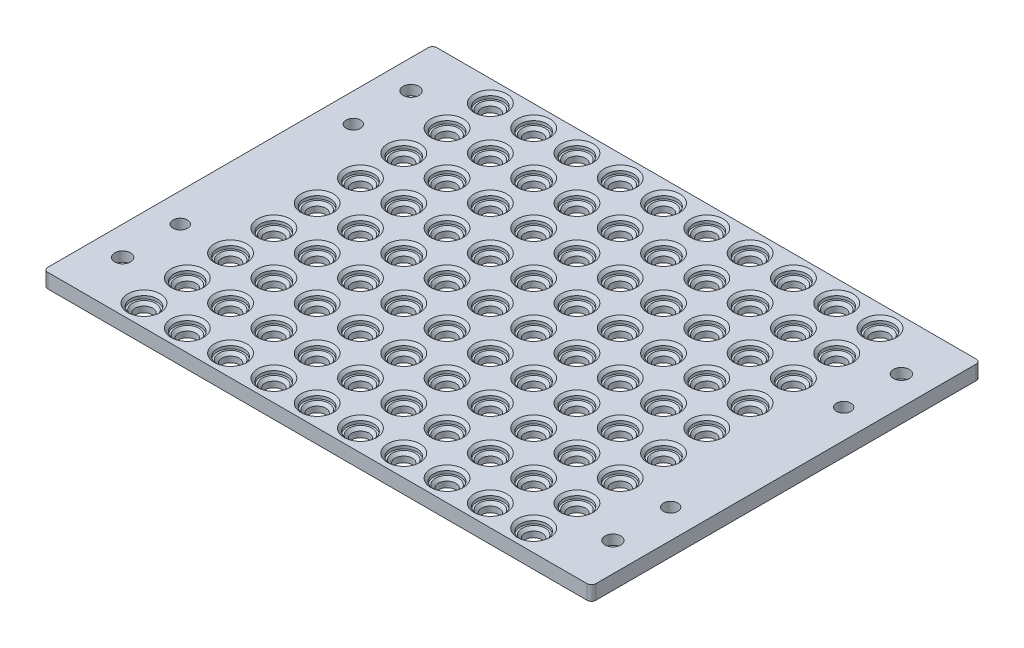
from build123d import *

# Parameters (mm, degrees)
SKETCH_1_W                         = 380
SKETCH_1_H                         = 269.8
EXTRUDE_1_DEPTH                    = 10
HOLE_WIZARD_1_D                    = 10
HOLE_WIZARD_3_D                    = 12
HOLE_WIZARD_4_D                    = 18.5
HOLE_WIZARD_4_DEPTH                = 4
CHAMFER_1_SIZE                     = 2
PATTERN_LINEAR_1_COUNT             = 10
PATTERN_LINEAR_1_PITCH             = 30.022
PATTERN_LINEAR_1_COUNT_DIR2        = 9
PATTERN_LINEAR_1_PITCH_DIR2        = 30.022
CHAMFER_1_OF_PATTERN_LINEAR_1_SIZE = 2
HOLE_WIZARD_1_2_D                  = 6.6
HOLE_WIZARD_1_2_CBORE_D            = 11
HOLE_WIZARD_1_2_CBORE_DEPTH        = 6.8
FILLET_1_R                         = 3


with BuildPart() as part:
    # 草图1 → 凸台-拉伸1 (new body)
    with BuildSketch(Plane(origin=(0, 0, 0), x_dir=(1, 0, 0), z_dir=(0, 1, 0))):
        Rectangle(SKETCH_1_W, SKETCH_1_H)
    extrude(amount=EXTRUDE_1_DEPTH)

    # Hole Wizard 1 (through all)
    with Locations(Plane(origin=(0, 10, 0), x_dir=(1, 0, 0), z_dir=(0, 1, 0))):
        with Locations((-170, 60), (170, 60), (170, -60), (-170, -60)):
            Hole(HOLE_WIZARD_1_D / 2)

    # 孔3 (through all)
    with Locations(Plane(origin=(0, 10, 0), x_dir=(1, 0, 0), z_dir=(0, 1, 0))):
        with Locations((135.099, -120.088)):
            hole_wizard_3 = Hole(HOLE_WIZARD_3_D / 2)

    # 孔4
    with Locations(Plane(origin=(0, 10, 0), x_dir=(1, 0, 0), z_dir=(0, 1, 0))):
        with Locations((135.099, -120.088)):
            hole_wizard_4 = Hole(HOLE_WIZARD_4_D / 2, depth=HOLE_WIZARD_4_DEPTH)

    # 倒角1
    chamfer_1_edges = [part.edges().sort_by_distance(p)[0] for p in [
        (141.099, 6, 120.088),
        (144.349, 10, 120.088),
    ]]
    chamfer(chamfer_1_edges, length=CHAMFER_1_SIZE)

    # 阵列(线性)1: 孔3, Hole Wizard 4 10 × 9
    with Locations(*[(-i * PATTERN_LINEAR_1_PITCH, 0, -j * PATTERN_LINEAR_1_PITCH_DIR2) for i in range(PATTERN_LINEAR_1_COUNT) for j in range(PATTERN_LINEAR_1_COUNT_DIR2) if (i, j) != (0, 0)]):
        add(hole_wizard_3, mode=Mode.SUBTRACT)
        add(hole_wizard_4, mode=Mode.SUBTRACT)

    # 倒角1 of 阵列(线性)1
    chamfer_1_of_pattern_linear_1_edges = [part.edges().sort_by_distance(p)[0] for p in [
        (141.099, 6, 90.066),
        (144.349, 10, 90.066),
        (141.099, 6, 60.044),
        (144.349, 10, 60.044),
        (141.099, 6, 30.022),
        (144.349, 10, 30.022),
        (141.099, 6, 0),
        (144.349, 10, 0),
        (141.099, 6, -30.022),
        (144.349, 10, -30.022),
        (141.099, 6, -60.044),
        (144.349, 10, -60.044),
        (141.099, 6, -90.066),
        (144.349, 10, -90.066),
        (141.099, 6, -120.088),
        (144.349, 10, -120.088),
        (111.077, 6, 120.088),
        (114.327, 10, 120.088),
        (111.077, 6, 90.066),
        (114.327, 10, 90.066),
        (111.077, 6, 60.044),
        (114.327, 10, 60.044),
        (111.077, 6, 30.022),
        (114.327, 10, 30.022),
        (111.077, 6, 0),
        (114.327, 10, 0),
        (111.077, 6, -30.022),
        (114.327, 10, -30.022),
        (111.077, 6, -60.044),
        (114.327, 10, -60.044),
        (111.077, 6, -90.066),
        (114.327, 10, -90.066),
        (111.077, 6, -120.088),
        (114.327, 10, -120.088),
        (81.055, 6, 120.088),
        (84.305, 10, 120.088),
        (81.055, 6, 90.066),
        (84.305, 10, 90.066),
        (81.055, 6, 60.044),
        (84.305, 10, 60.044),
        (81.055, 6, 30.022),
        (84.305, 10, 30.022),
        (81.055, 6, 0),
        (84.305, 10, 0),
        (81.055, 6, -30.022),
        (84.305, 10, -30.022),
        (81.055, 6, -60.044),
        (84.305, 10, -60.044),
        (81.055, 6, -90.066),
        (84.305, 10, -90.066),
        (81.055, 6, -120.088),
        (84.305, 10, -120.088),
        (51.033, 6, 120.088),
        (54.283, 10, 120.088),
        (51.033, 6, 90.066),
        (54.283, 10, 90.066),
        (51.033, 6, 60.044),
        (54.283, 10, 60.044),
        (51.033, 6, 30.022),
        (54.283, 10, 30.022),
        (51.033, 6, 0),
        (54.283, 10, 0),
        (51.033, 6, -30.022),
        (54.283, 10, -30.022),
        (51.033, 6, -60.044),
        (54.283, 10, -60.044),
        (51.033, 6, -90.066),
        (54.283, 10, -90.066),
        (51.033, 6, -120.088),
        (54.283, 10, -120.088),
        (21.011, 6, 120.088),
        (24.261, 10, 120.088),
        (21.011, 6, 90.066),
        (24.261, 10, 90.066),
        (21.011, 6, 60.044),
        (24.261, 10, 60.044),
        (21.011, 6, 30.022),
        (24.261, 10, 30.022),
        (21.011, 6, 0),
        (24.261, 10, 0),
        (21.011, 6, -30.022),
        (24.261, 10, -30.022),
        (21.011, 6, -60.044),
        (24.261, 10, -60.044),
        (21.011, 6, -90.066),
        (24.261, 10, -90.066),
        (21.011, 6, -120.088),
        (24.261, 10, -120.088),
        (-9.011, 6, 120.088),
        (-5.761, 10, 120.088),
        (-9.011, 6, 90.066),
        (-5.761, 10, 90.066),
        (-9.011, 6, 60.044),
        (-5.761, 10, 60.044),
        (-9.011, 6, 30.022),
        (-5.761, 10, 30.022),
        (-9.011, 6, 0),
        (-5.761, 10, 0),
        (-9.011, 6, -30.022),
        (-5.761, 10, -30.022),
        (-9.011, 6, -60.044),
        (-5.761, 10, -60.044),
        (-9.011, 6, -90.066),
        (-5.761, 10, -90.066),
        (-9.011, 6, -120.088),
        (-5.761, 10, -120.088),
        (-39.033, 6, 120.088),
        (-35.783, 10, 120.088),
        (-39.033, 6, 90.066),
        (-35.783, 10, 90.066),
        (-39.033, 6, 60.044),
        (-35.783, 10, 60.044),
        (-39.033, 6, 30.022),
        (-35.783, 10, 30.022),
        (-39.033, 6, 0),
        (-35.783, 10, 0),
        (-39.033, 6, -30.022),
        (-35.783, 10, -30.022),
        (-39.033, 6, -60.044),
        (-35.783, 10, -60.044),
        (-39.033, 6, -90.066),
        (-35.783, 10, -90.066),
        (-39.033, 6, -120.088),
        (-35.783, 10, -120.088),
        (-69.055, 6, 120.088),
        (-65.805, 10, 120.088),
        (-69.055, 6, 90.066),
        (-65.805, 10, 90.066),
        (-69.055, 6, 60.044),
        (-65.805, 10, 60.044),
        (-69.055, 6, 30.022),
        (-65.805, 10, 30.022),
        (-69.055, 6, 0),
        (-65.805, 10, 0),
        (-69.055, 6, -30.022),
        (-65.805, 10, -30.022),
        (-69.055, 6, -60.044),
        (-65.805, 10, -60.044),
        (-69.055, 6, -90.066),
        (-65.805, 10, -90.066),
        (-69.055, 6, -120.088),
        (-65.805, 10, -120.088),
        (-99.077, 6, 120.088),
        (-95.827, 10, 120.088),
        (-99.077, 6, 90.066),
        (-95.827, 10, 90.066),
        (-99.077, 6, 60.044),
        (-95.827, 10, 60.044),
        (-99.077, 6, 30.022),
        (-95.827, 10, 30.022),
        (-99.077, 6, 0),
        (-95.827, 10, 0),
        (-99.077, 6, -30.022),
        (-95.827, 10, -30.022),
        (-99.077, 6, -60.044),
        (-95.827, 10, -60.044),
        (-99.077, 6, -90.066),
        (-95.827, 10, -90.066),
        (-99.077, 6, -120.088),
        (-95.827, 10, -120.088),
        (-129.099, 6, 120.088),
        (-125.849, 10, 120.088),
        (-129.099, 6, 90.066),
        (-125.849, 10, 90.066),
        (-129.099, 6, 60.044),
        (-125.849, 10, 60.044),
        (-129.099, 6, 30.022),
        (-125.849, 10, 30.022),
        (-129.099, 6, 0),
        (-125.849, 10, 0),
        (-129.099, 6, -30.022),
        (-125.849, 10, -30.022),
        (-129.099, 6, -60.044),
        (-125.849, 10, -60.044),
        (-129.099, 6, -90.066),
        (-125.849, 10, -90.066),
        (-129.099, 6, -120.088),
        (-125.849, 10, -120.088),
    ]]
    chamfer(chamfer_1_of_pattern_linear_1_edges, length=CHAMFER_1_OF_PATTERN_LINEAR_1_SIZE)

    # Hole Wizard 1 2 (through all)
    with Locations(Plane(origin=(0, 10, 0), x_dir=(1, 0, 0), z_dir=(0, 1, 0))):
        with Locations((-170, 100), (-170, -100), (170, -100), (170, 100)):
            CounterBoreHole(HOLE_WIZARD_1_2_D / 2, HOLE_WIZARD_1_2_CBORE_D / 2, HOLE_WIZARD_1_2_CBORE_DEPTH)

    # 圆角1
    fillet_1_edges = [part.edges().sort_by_distance(p)[0] for p in [
        (-190, 5, -134.9),
        (190, 5, -134.9),
        (190, 5, 134.9),
        (-190, 5, 134.9),
    ]]
    fillet(fillet_1_edges, radius=FILLET_1_R)


solid = part.part
